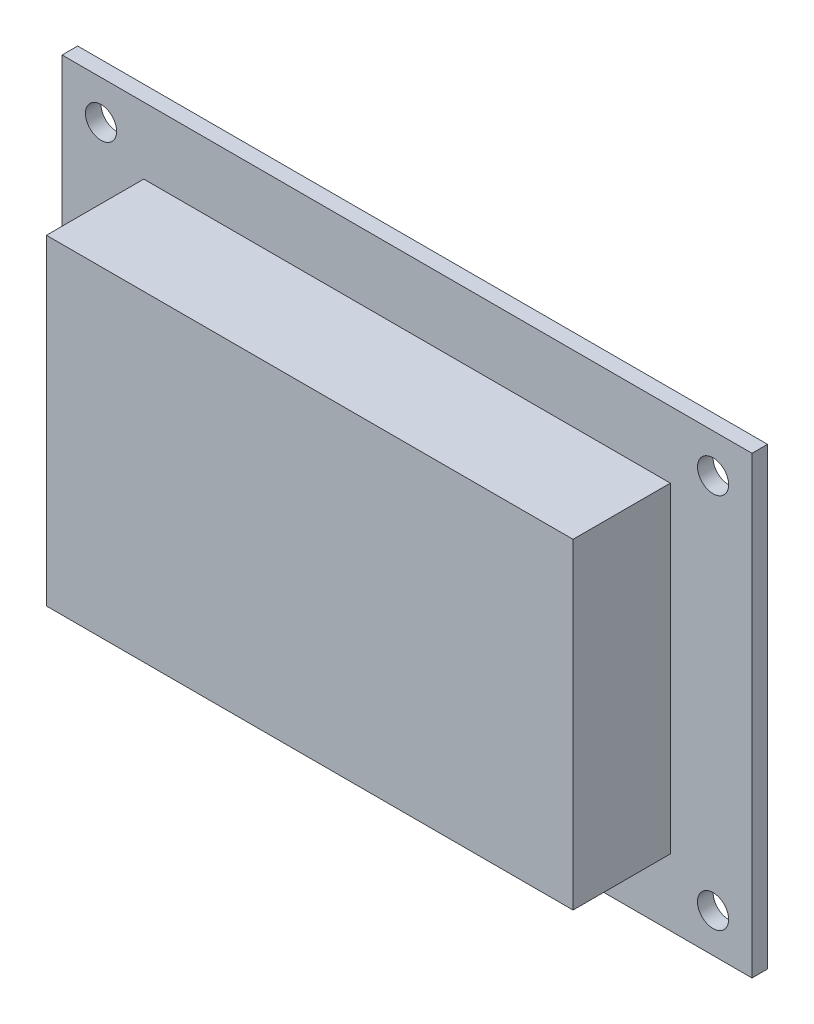
from build123d import *

# Parameters (mm, degrees)
ESBO_O1_W                = 70.9
ESBO_O1_H                = 46.7
ESBO_O1_R                = 1.6
RESSALTO_EXTRUS_O1_DEPTH = 1.6
ESBO_O2_W                = 54.120377738
ESBO_O2_H                = 33.000230328
RESSALTO_EXTRUS_O2_DEPTH = 10


with BuildPart() as part:
    # Esboço1 → Ressalto-extrusão1 (new body)
    with BuildSketch(Plane.XY):
        Rectangle(ESBO_O1_W, ESBO_O1_H)
        with Locations((-31.45, 19.35)):
            Circle(ESBO_O1_R, mode=Mode.SUBTRACT)
        with Locations((31.45, 19.35)):
            Circle(ESBO_O1_R, mode=Mode.SUBTRACT)
        with Locations((31.45, -19.35)):
            Circle(ESBO_O1_R, mode=Mode.SUBTRACT)
        with Locations((-31.45, -19.35)):
            Circle(ESBO_O1_R, mode=Mode.SUBTRACT)
    extrude(amount=RESSALTO_EXTRUS_O1_DEPTH)

    # Esboço2 → Ressalto-extrusão2 (add)
    with BuildSketch(Plane.XY.offset(1.6)):
        Rectangle(ESBO_O2_W, ESBO_O2_H)
    extrude(amount=RESSALTO_EXTRUS_O2_DEPTH)


solid = part.part
